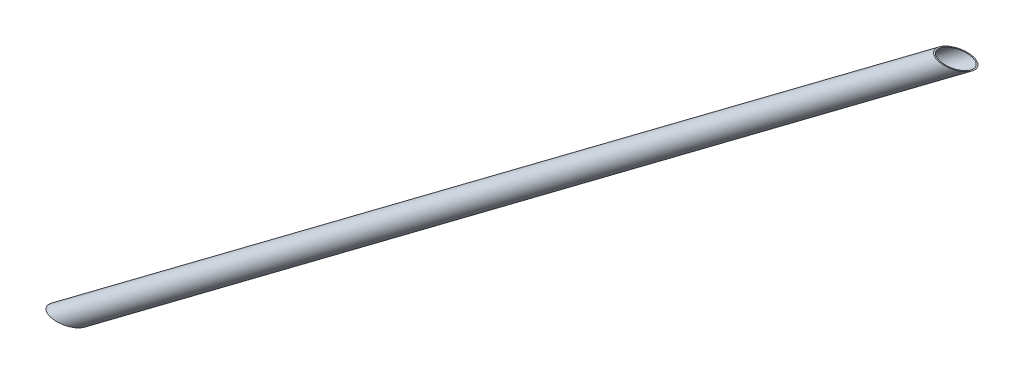
from build123d import *

# Parameters (mm, degrees)
CORTAR_EXTRUIR1_DEPTH      = 2559.386642797
CORTAR_EXTRUIR1_DEPTH_BACK = 2559.386642797


with BuildPart() as part:
    # Croquis1 → Revolución1 (revolve)
    with BuildSketch(Plane.XY):
        Polygon((2042.333333333, 1500), (15.24, -20.32), (14.04, -18.72), (2041.133333333, 1501.6), align=None)
    revolve(axis=Axis((2027.093333333, 1520.32, 0), (-0.8, -0.6, 0)))

    # Croquis2 → Cortar-Extruir1 (cut, two sides: drawn at the far end of the back side and taken through both)
    with BuildSketch(Plane.XY.offset(-CORTAR_EXTRUIR1_DEPTH_BACK)):
        Polygon((-15.24, 20.32), (69.426666667, 20.32), (15.24, -20.32), align=None)
        Polygon((2042.333333333, 1500), (1957.666666667, 1500), (2011.853333333, 1540.64), align=None)
    extrude(amount=CORTAR_EXTRUIR1_DEPTH + CORTAR_EXTRUIR1_DEPTH_BACK, mode=Mode.SUBTRACT)


solid = part.part
